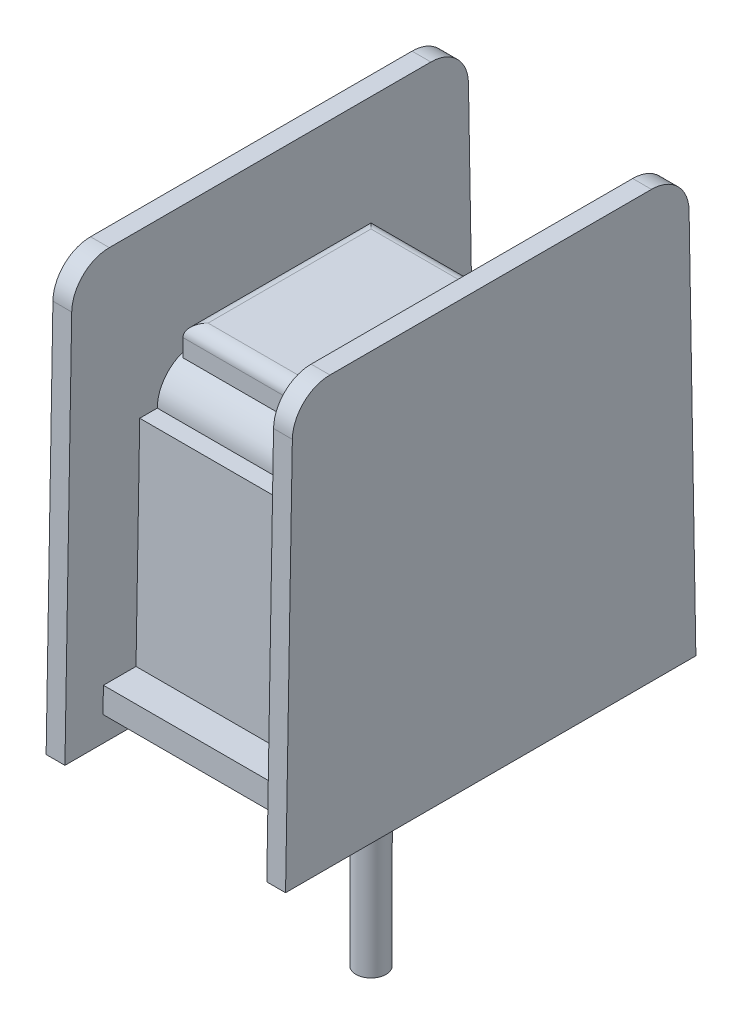
from build123d import *

# Parameters (mm, degrees)
SKETCH_1_W          = 9.55
SKETCH_1_H          = 16
EXTRUDE_1_DEPTH     = 17
SKETCH_2_W          = 8.05
SKETCH_2_H          = 16
CUT_EXTRUDE_1_DEPTH = 6.5
SKETCH_5_W          = 8.05
SKETCH_5_H          = 8.5
CUT_EXTRUDE_4_DEPTH = 2.8
SKETCH_6_W          = 8.05
SKETCH_6_H          = 2
CUT_EXTRUDE_5_DEPTH = 1.5
DRAFT_1_ANGLE       = 1
SKETCH_7_W          = 8.05
SKETCH_7_H          = 13.366556364
CUT_EXTRUDE_6_DEPTH = 1
FILLET_1_R          = 1.5
SKETCH_8_W          = 8.05
SKETCH_8_H          = 9
EXTRUDE_1747_DEPTH  = 1.5
SKETCH_9_R          = 0.6
EXTRUDE_3_DEPTH     = 10
FILLET_2_R          = 1.5
SKETCH_10_W         = 7.5
SKETCH_10_H         = 7.5
EXTRUDE_4_DEPTH     = 1.2
FILLET_4_R          = 0.5


with BuildPart() as part:
    # 草图1 → 拉伸1 (new body)
    with BuildSketch(Plane(origin=(0, 0, 0), x_dir=(1, 0, 0), z_dir=(0, 1, 0))):
        Rectangle(SKETCH_1_W, SKETCH_1_H)
    extrude(amount=EXTRUDE_1_DEPTH)

    # 草图2 → 切除-拉伸1 (cut)
    with BuildSketch(Plane(origin=(0, 17, 0), x_dir=(-1, 0, 0), z_dir=(0, 1, 0))):
        Rectangle(SKETCH_2_W, SKETCH_2_H)
    extrude(amount=-CUT_EXTRUDE_1_DEPTH, mode=Mode.SUBTRACT)

    # 草图5 → 切除-拉伸4 (cut)
    with BuildSketch(Plane(origin=(0, 0, -8), x_dir=(-1, 0, 0), z_dir=(0, 0, -1))):
        with Locations((0, 6.25)):
            Rectangle(SKETCH_5_W, SKETCH_5_H)
    cut_extrude_4 = extrude(amount=-CUT_EXTRUDE_4_DEPTH, mode=Mode.SUBTRACT)

    # 草图6 → 切除-拉伸5 (cut)
    with BuildSketch(Plane(origin=(0, 0, -8), x_dir=(-1, 0, 0), z_dir=(0, 0, -1))):
        with Locations((0, 1)):
            Rectangle(SKETCH_6_W, SKETCH_6_H)
    cut_extrude_5 = extrude(amount=-CUT_EXTRUDE_5_DEPTH, mode=Mode.SUBTRACT)

    # 镜向3: 切除-拉伸4, 切除-拉伸5 across plane
    add(cut_extrude_4.mirror(Plane.XY), mode=Mode.SUBTRACT)
    add(cut_extrude_5.mirror(Plane.XY), mode=Mode.SUBTRACT)

    # 拔模1
    draft_1_faces = [part.faces().sort_by_distance(p)[0] for p in [
        (4.4, 8.5, 8),
        (-4.4, 8.5, 8),
        (0, 1, 6.5),
        (0, 6.25, 5.2),
        (0, 1, -6.5),
        (-4.4, 8.5, -8),
        (0, 6.25, -5.2),
        (4.4, 8.5, -8),
    ]]
    draft(draft_1_faces, Plane(origin=(4.025, 10.5, -8), x_dir=(0, 0, 1), z_dir=(0, 1, 0)), DRAFT_1_ANGLE)

    # 草图7 → 切除-拉伸6 (cut)
    with BuildSketch(Plane.XZ):
        Rectangle(SKETCH_7_W, SKETCH_7_H)
    extrude(amount=-CUT_EXTRUDE_6_DEPTH, mode=Mode.SUBTRACT)

    # 圆角1
    fillet_1_edges = [part.edges().sort_by_distance(p)[0] for p in [
        (4.4, 17, -7.886542078),
        (4.4, 17, 7.886542078),
        (-4.4, 17, -7.886542078),
        (-4.4, 17, 7.886542078),
    ]]
    fillet(fillet_1_edges, radius=FILLET_1_R)

    # 草图8 → Extrude 1747 (add)
    with BuildSketch(Plane(origin=(0, 10.5, 0), x_dir=(-1, 0, 0), z_dir=(0, 1, 0))):
        Rectangle(SKETCH_8_W, SKETCH_8_H)
    extrude(amount=EXTRUDE_1747_DEPTH)

    # 草图9 → 拉伸3 (add)
    with BuildSketch(Plane.XZ.offset(-1)):
        with Locations(Location((0, 0, 0), (0, 0, 90))):
            Circle(SKETCH_9_R)
    extrude(amount=EXTRUDE_3_DEPTH)

    # 圆角2
    fillet_2_edges = [part.edges().sort_by_distance(p)[0] for p in [
        (0, 12, -4.5),
        (0, 12, 4.5),
    ]]
    fillet(fillet_2_edges, radius=FILLET_2_R - 0.0001)  # a hair under: the kernel refuses the full size

    # 草图10 → 拉伸4 (add)
    with BuildSketch(Plane(origin=(0, 12, 0), x_dir=(-1, 0, 0), z_dir=(0, 1, 0))):
        Rectangle(SKETCH_10_W, SKETCH_10_H)
    extrude(amount=EXTRUDE_4_DEPTH)

    # 圆角4
    fillet_4_edges = [part.edges().sort_by_distance(p)[0] for p in [
        (3.75, 13.2, 0),
        (0, 13.2, -3.75),
        (-3.75, 13.2, 0),
        (0, 13.2, 3.75),
    ]]
    fillet(fillet_4_edges, radius=FILLET_4_R)


solid = part.part
